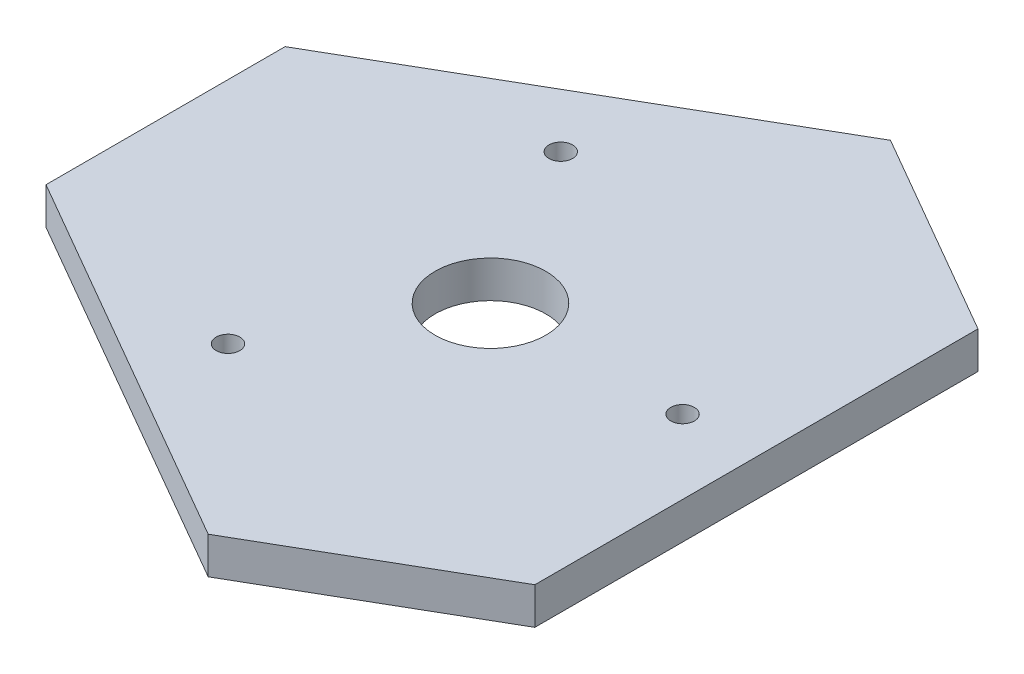
from build123d import *

# Parameters (mm, degrees)
SKETCH2_R           = 1.016
SKETCH2_R_2         = 4.7625
BOSS_EXTRUDE2_DEPTH = 3.175


with BuildPart() as part:
    # Sketch2 → Boss-Extrude2 (new body)
    with BuildSketch(Plane(origin=(0, 0, 0), x_dir=(1, 0, 0), z_dir=(0, 1, 0))):
        Polygon((22.868144039, 19.05), (22.868144039, -19.05), (5.063711923, -29.329393675), (-27.931855961, -10.279393675), (-27.931855961, 10.279393675), (5.063711923, 29.329393675), align=None)
        with Locations((16.518144039, 0)):
            Circle(SKETCH2_R, mode=Mode.SUBTRACT)
        with Locations((-8.259072019, -14.305132361)):
            Circle(SKETCH2_R, mode=Mode.SUBTRACT)
        with Locations((-8.259072019, 14.305132361)):
            Circle(SKETCH2_R, mode=Mode.SUBTRACT)
        Circle(SKETCH2_R_2, mode=Mode.SUBTRACT)
    extrude(amount=BOSS_EXTRUDE2_DEPTH)


solid = part.part
